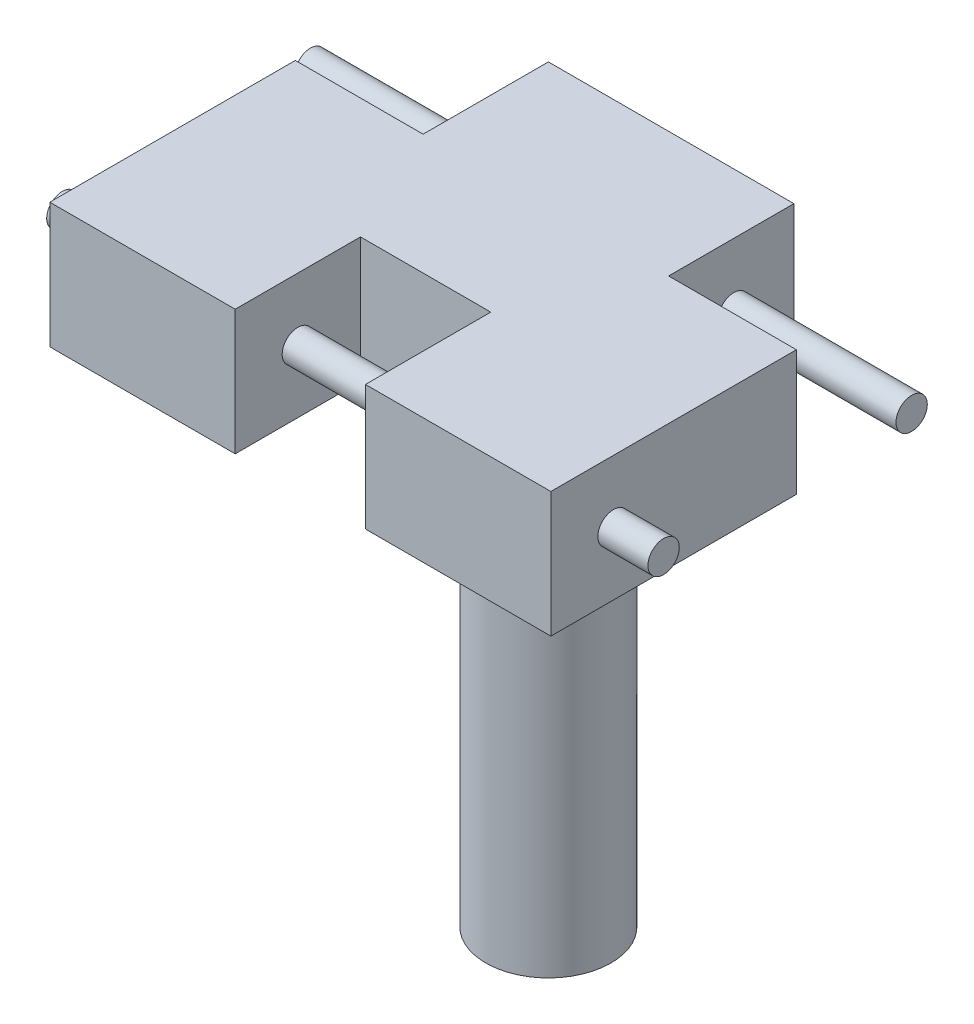
from build123d import *

# Parameters (mm, degrees)
FINGERBASE_DEPTH         = 6.35
BOSS_EXTRUDE1_DEPTH      = 2.54
BOSS_EXTRUDE1_DEPTH_BACK = 27.94
SKETCH2_R                = 0.79375
SKETCH3_R                = 3.175
BOSS_EXTRUDE2_DEPTH      = 25.4


with BuildPart() as part:
    # Sketch1 → FingerBase (new body)
    with BuildSketch(Plane(origin=(0, 0, 0), x_dir=(1, 0, 0), z_dir=(0, 1, 0))):
        Polygon((-6.223, 6.223), (6.223, 6.223), (6.223, -0.127), (12.7, -0.127), (12.7, -12.573), (3.302, -12.573), (3.302, -6.223), (-3.302, -6.223), (-3.302, -12.573), (-12.7, -12.573), (-12.7, -0.127), (-6.223, -0.127), align=None)
    extrude(amount=FINGERBASE_DEPTH)

    # Sketch2 → Boss-Extrude1 (add, two sides: drawn at the far end of the back side and taken through both)
    with BuildSketch(Plane(origin=(12.7, 0, 0), x_dir=(0, 0, -1), z_dir=(1, 0, 0)).offset(-BOSS_EXTRUDE1_DEPTH_BACK)):
        with Locations((-9.398, 3.175)):
            Circle(SKETCH2_R)
        with Locations((3.175, 3.175)):
            Circle(SKETCH2_R)
    extrude(amount=BOSS_EXTRUDE1_DEPTH + BOSS_EXTRUDE1_DEPTH_BACK)

    # Sketch3 → Boss-Extrude2 (add)
    with BuildSketch(Plane.XZ):
        Circle(SKETCH3_R)
    extrude(amount=BOSS_EXTRUDE2_DEPTH)


solid = part.part
